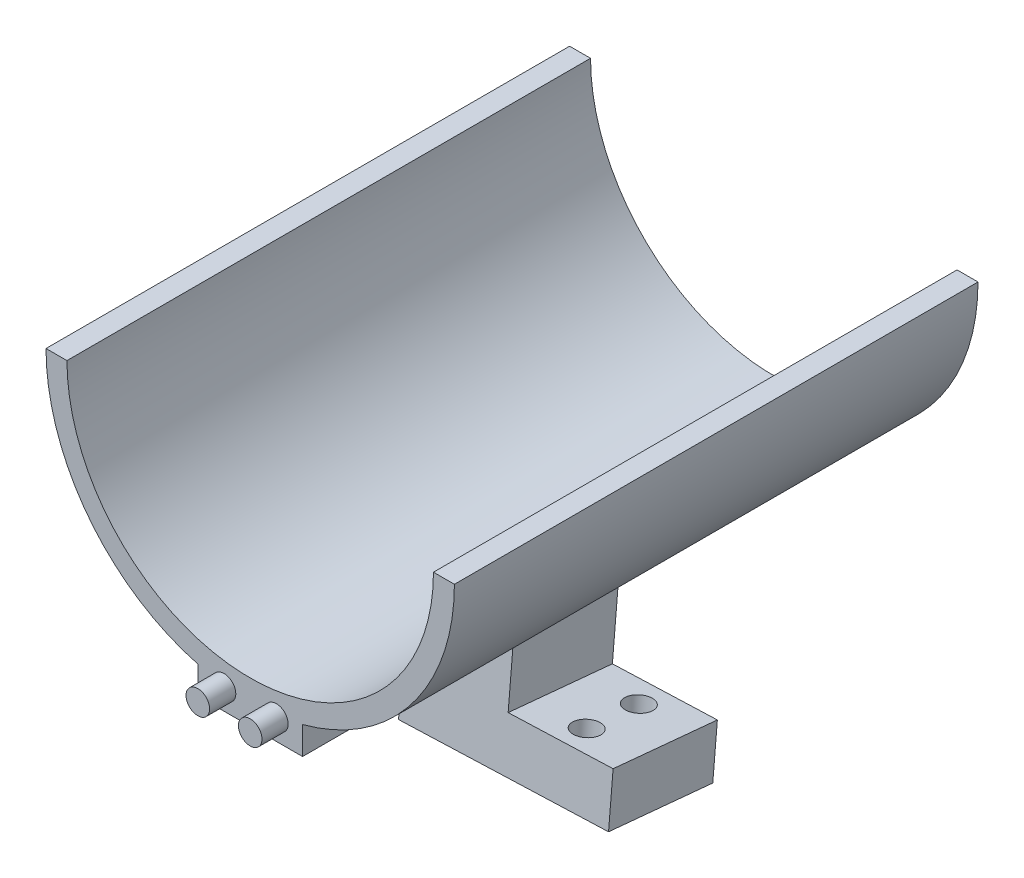
from build123d import *

# Parameters (mm, degrees)
EXTRUDE_THIN1_DEPTH       = 100
BOSS_EXTRUDE1_START       = -10
BOSS_EXTRUDE1_DEPTH       = 10
SKETCH3_R                 = 2.25
BOSS_EXTRUDE2_DEPTH       = 5
BOSS_EXTRUDE3_DEPTH       = 10
SKETCH5_R                 = 2.25
CUT_EXTRUDE1_DEPTH        = 6
BOSS_EXTRUDE4_REACH       = 121.416
BOSS_EXTRUDE4_END_RADIUS  = 39
SKETCH10_W                = 20
SKETCH10_H                = 20
BOSS_EXTRUDE5_START       = -19.757252304
BOSS_EXTRUDE5_OUTLINE_W   = 20
BOSS_EXTRUDE5_OUTLINE_H   = 20
BOSS_EXTRUDE5_DEPTH       = 19.757252304
BOSS_EXTRUDE5_START_2     = 71.178890271
BOSS_EXTRUDE5_2_OUTLINE_W = 23
BOSS_EXTRUDE5_2_OUTLINE_H = 23
BOSS_EXTRUDE5_2_DEPTH     = 1.821109729
BOSS_EXTRUDE6_DEPTH       = 20
SKETCH12_R                = 2.5
CUT_EXTRUDE2_DEPTH        = 20


with BuildPart() as part:
    # Sketch1 → Extrude-Thin1 (new body)
    with BuildSketch(Plane.XY):
        with BuildLine():
            ThreePointArc((-35, 0), (0, -35), (35, 0))
            Line((35, 0), (39, 0))
            ThreePointArc((39, 0), (0, -39), (-39, 0))
            Line((-39, 0), (-35, 0))
        make_face()
    extrude(amount=EXTRUDE_THIN1_DEPTH)

    # Sketch2 → Boss-Extrude1 (add)
    with BuildSketch(Plane.XY.offset(100).offset(BOSS_EXTRUDE1_START)):
        with BuildLine():
            Line((0, -39), (0, -35))
            Line((0, -35), (-10, -35))
            Line((-10, -35), (-10, -37.69615365))
            ThreePointArc((-10, -37.69615365), (-5.042321274, -38.672664715), (0, -39))
        make_face()
        with BuildLine():
            Line((10, -35), (0, -35))
            Line((0, -35), (0, -39))
            ThreePointArc((0, -39), (5.042321274, -38.672664715), (10, -37.69615365))
            Line((10, -37.69615365), (10, -35))
        make_face()
        with BuildLine():
            ThreePointArc((10, -37.69615365), (5.042321274, -38.672664715), (0, -39))
            ThreePointArc((0, -39), (-5.042321274, -38.672664715), (-10, -37.69615365))
            Line((-10, -37.69615365), (-10, -43))
            Line((-10, -43), (10, -43))
            Line((10, -43), (10, -37.69615365))
        make_face()
    extrude(amount=BOSS_EXTRUDE1_DEPTH)

    # Sketch3 → Boss-Extrude2 (add)
    with BuildSketch(Plane.XY.offset(100)):
        with Locations((-5, -39)):
            Circle(SKETCH3_R)
        with Locations((5, -39)):
            Circle(SKETCH3_R)
    extrude(amount=BOSS_EXTRUDE2_DEPTH)

    # Sketch4 → Boss-Extrude3 (add)
    with BuildSketch(Plane(origin=(0, 0, 0), x_dir=(-1, 0, 0), z_dir=(0, 0, -1))):
        with BuildLine():
            Line((0, -39), (0, -35))
            Line((0, -35), (-10, -35))
            Line((-10, -35), (-10, -37.69615365))
            ThreePointArc((-10, -37.69615365), (-5.042321274, -38.672664715), (0, -39))
        make_face()
        with BuildLine():
            ThreePointArc((10, -37.69615365), (5.042321274, -38.672664715), (0, -39))
            ThreePointArc((0, -39), (-5.042321274, -38.672664715), (-10, -37.69615365))
            Line((-10, -37.69615365), (-10, -43))
            Line((-10, -43), (10, -43))
            Line((10, -43), (10, -37.69615365))
        make_face()
        with BuildLine():
            Line((10, -35), (0, -35))
            Line((0, -35), (0, -39))
            ThreePointArc((0, -39), (5.042321274, -38.672664715), (10, -37.69615365))
            Line((10, -37.69615365), (10, -35))
        make_face()
    extrude(amount=-BOSS_EXTRUDE3_DEPTH)

    # Sketch5 → Cut-Extrude1 (cut)
    with BuildSketch(Plane(origin=(0, 0, 0), x_dir=(-1, 0, 0), z_dir=(0, 0, -1))):
        with Locations(Location((-5, -39, 0), (0, 0, 180))):
            Circle(SKETCH5_R)
        with Locations(Location((5, -39, 0), (0, 0, 180))):
            Circle(SKETCH5_R)
    extrude(amount=-CUT_EXTRUDE1_DEPTH, mode=Mode.SUBTRACT)

    # Boss-Extrude4: up to this cylinder (the profile starts outside it)
    boss_extrude4_end = Plane(origin=(0, 0, 50), z_dir=(0, 0, -1)) * Cylinder(BOSS_EXTRUDE4_END_RADIUS, 321.832, mode=Mode.PRIVATE)
    # Sketch10 → Boss-Extrude4 (add, up to the surface)
    with BuildSketch(Plane(origin=(0, -51.355775573, 4.493048169), x_dir=(1, 0, 0), z_dir=(0, 0.9961946980917462, -0.08715574274765152)), mode=Mode.PRIVATE) as boss_extrude4_sk1:
        with Locations((0, -45.680780994)):
            Rectangle(SKETCH10_W, SKETCH10_H)
    boss_extrude4_tool1 = extrude(boss_extrude4_sk1.sketch, amount=BOSS_EXTRUDE4_REACH, mode=Mode.PRIVATE) - boss_extrude4_end
    add(boss_extrude4_tool1.solids().sort_by_distance((0, -47.374433, 50))[0])

    # Boss-Extrude5: read off the stored shape, not the designer's step
    # Boss-Extrude5 outline → Boss-Extrude5 (add)
    with BuildSketch(Plane(origin=(0, -51.355775573, 4.493048169), x_dir=(1, 0, 0), z_dir=(0, 0.9961946980917462, -0.08715574274765152)).offset(BOSS_EXTRUDE5_START)):
        with Locations((0, -45.680780994)):
            Rectangle(BOSS_EXTRUDE5_OUTLINE_W, BOSS_EXTRUDE5_OUTLINE_H)
    extrude(amount=BOSS_EXTRUDE5_DEPTH)

    # Boss-Extrude5 2 outline → Boss-Extrude5 2 (cut)
    with BuildSketch(Plane(origin=(0, 0, 0), x_dir=(0.9994119135527714, 0.0341374804572781, -0.0032341114416133587), z_dir=(0.034290334626361094, -0.9949568891477218, 0.09426007473315587)).offset(BOSS_EXTRUDE5_START_2)):
        with Locations((-2.5, 45.5)):
            Rectangle(BOSS_EXTRUDE5_2_OUTLINE_W, BOSS_EXTRUDE5_2_OUTLINE_H)
    extrude(amount=BOSS_EXTRUDE5_2_DEPTH, mode=Mode.SUBTRACT)

    # Sketch11 → Boss-Extrude6 (add, along a direction that is not the sketch's normal)
    with BuildSketch(Plane(origin=(10, 0, 0), x_dir=(0, 0, -1), z_dir=(1, 0, 0))):
        Polygon((-41.700202309, -67.244443924), (-40.825315674, -57.244443924), (-60.736677348, -55.358084364), (-61.611563983, -65.358084364), align=None)
    extrude(amount=BOSS_EXTRUDE6_DEPTH, dir=(0.9994118831812419, 0.03416073136677643, -0.002988676732382235))

    # Sketch12 → Cut-Extrude2 (cut)
    with BuildSketch(Plane(origin=(2.096746102, -60.838484135, 5.763707075), x_dir=(0.9994101830326217, 0.03396190638807499, -0.005086744065644943), z_dir=(-0.03429033462636107, 0.994956889147722, -0.09426007473315641))):
        with Locations(Location((17.832976273, -40.280011427, 0), (0, 0, 269.893376297))):
            Circle(SKETCH12_R)
        with Locations(Location((17.814365976, -50.280510703, 0), (0, 0, 269.893376297))):
            Circle(SKETCH12_R)
    extrude(amount=-CUT_EXTRUDE2_DEPTH, mode=Mode.SUBTRACT)


solid = part.part
